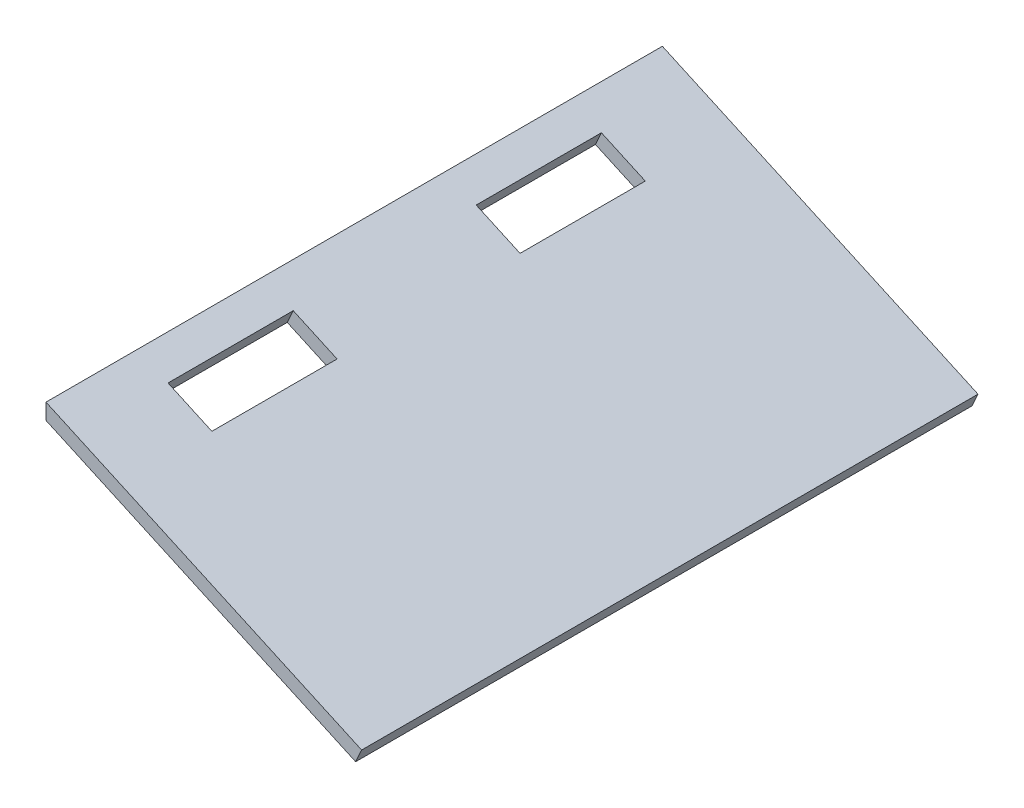
from build123d import *

# Parameters (mm, degrees)
BOSS_EXTRUDE1_DEPTH = 812.8
SKETCH8_W           = 63.5
SKETCH8_H           = 165.1
CUT_EXTRUDE1_DEPTH  = 19.05


with BuildPart() as part:
    # Sketch6 → Boss-Extrude1 (new body)
    with BuildSketch(Plane.XY):
        Polygon((-737.18449825, 1672.01539481), (-737.18449825, 1692.941033519), (-320.964944754, 1503.750327384), (-328.847890843, 1486.407845989), align=None)
    extrude(amount=BOSS_EXTRUDE1_DEPTH)

    # Sketch8 → Cut-Extrude1 (cut)
    with BuildSketch(Plane(origin=(503.63859081, 1108.004899783, 0), x_dir=(0.9103664774626058, -0.41380294430118175, 0), z_dir=(-0.41380294430118175, -0.9103664774626058, 0))):
        with Locations((-1295.655978481, 203.2)):
            Rectangle(SKETCH8_W, SKETCH8_H)
        with Locations((-1295.655978481, 609.6)):
            Rectangle(SKETCH8_W, SKETCH8_H)
    extrude(amount=-CUT_EXTRUDE1_DEPTH, mode=Mode.SUBTRACT)


solid = part.part
